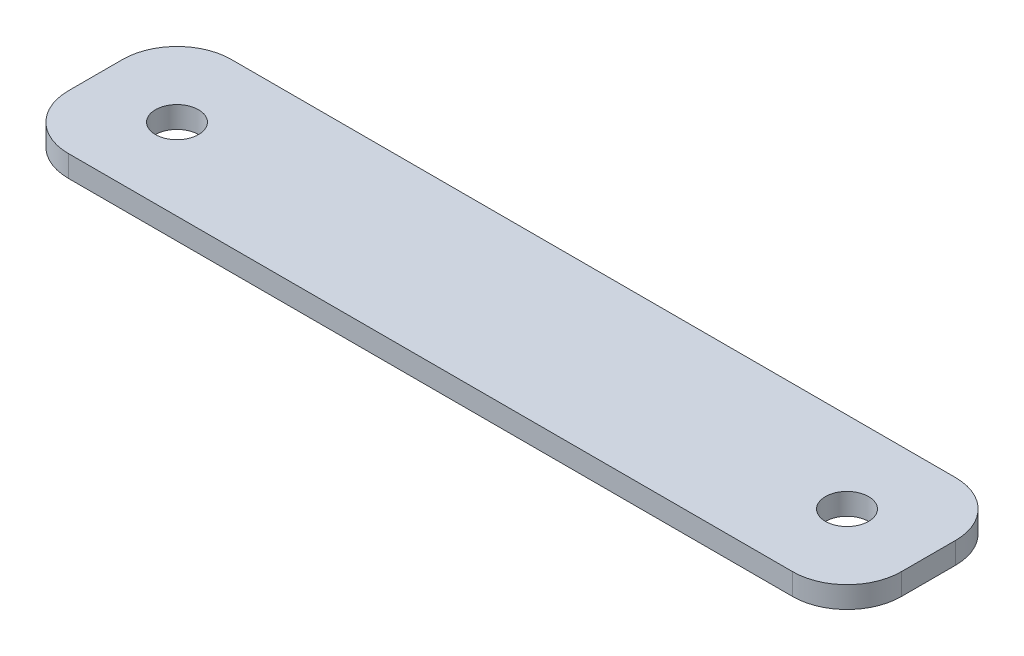
from build123d import *

# Parameters (mm, degrees)
SKETCH1_W           = 61.344
SKETCH1_H           = 12
SKETCH1_R           = 1.5875
BOSS_EXTRUDE1_DEPTH = 0.79375
FILLET1_R           = 4


with BuildPart() as part:
    # Sketch1 → Boss-Extrude1 (new, symmetric)
    with BuildSketch(Plane(origin=(0, 0, 0), x_dir=(1, 0, 0), z_dir=(0, 1, 0))):
        Rectangle(SKETCH1_W, SKETCH1_H)
        with Locations((-24.672, 0)):
            Circle(SKETCH1_R, mode=Mode.SUBTRACT)
        with Locations((24.672, 0)):
            Circle(SKETCH1_R, mode=Mode.SUBTRACT)
    extrude(amount=BOSS_EXTRUDE1_DEPTH, both=True)

    # Fillet1
    fillet1_edges = [part.edges().sort_by_distance(p)[0] for p in [
        (-30.672, 0, 6),
        (-30.672, 0, -6),
        (30.672, 0, 6),
        (30.672, 0, -6),
    ]]
    fillet(fillet1_edges, radius=FILLET1_R)


solid = part.part
